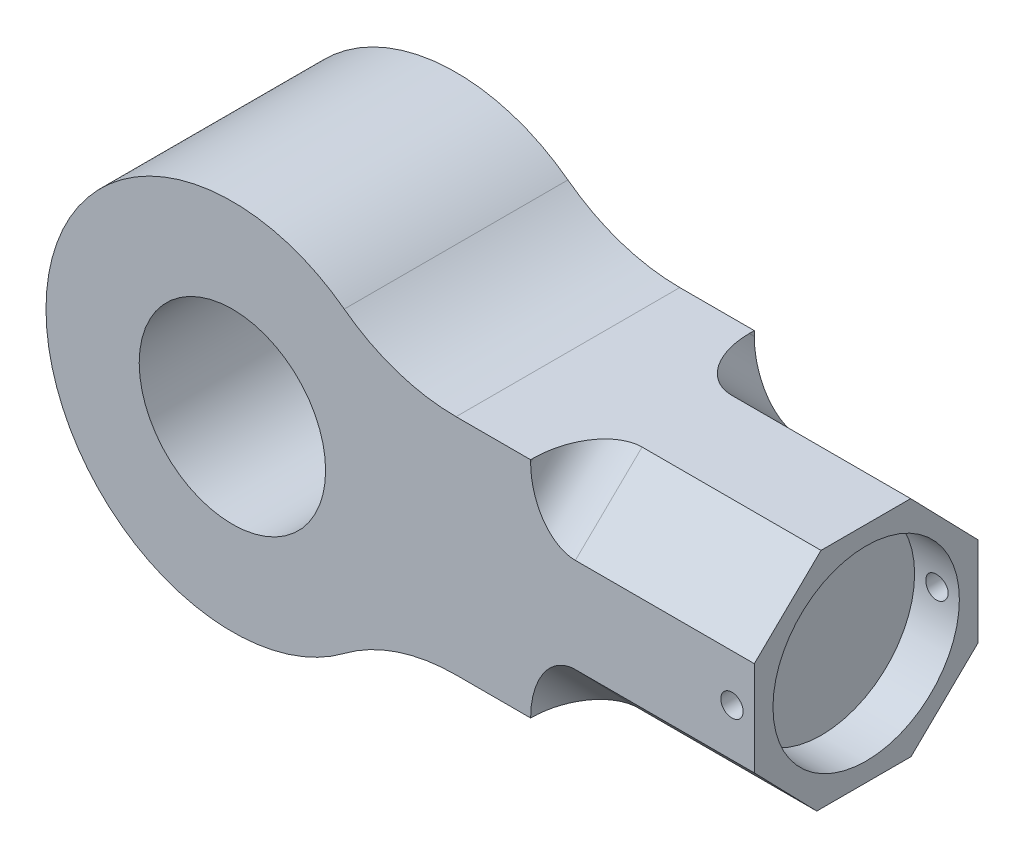
from build123d import *

# Parameters (mm, degrees)
SKETCH1_R              = 250
BOSS_EXTRUDE1_DEPTH    = 600
CUT_EXTRUDE6_DEPTH     = 600
CUT_EXTRUDE8_START     = -1
CUT_EXTRUDE8_OUTLINE_W = 600
CUT_EXTRUDE8_OUTLINE_H = 174.000412652
CUT_EXTRUDE8_DEPTH     = 1
FILLET2_R              = 120
SKETCH8_R              = 250
CUT_EXTRUDE10_DEPTH    = 120
SKETCH9_R              = 30
CUT_EXTRUDE11_DEPTH    = 1604.121954188


# Read off the part's stored shape, not the designer's step: Cut-Extrude8
with BuildPart() as part:
    # Sketch1 → Boss-Extrude1 (new body)
    with BuildSketch(Plane.XY):
        with BuildLine():
            Line((600, 300), (1400, 300))
            Line((1400, 300), (1400, -300))
            Line((1400, -300), (600, -300))
            ThreePointArc((600, -300), (441.886116992, -325.658350975), (300, -400))
            ThreePointArc((300, -400), (-500, 0), (300, 400))
            ThreePointArc((300, 400), (441.886116992, 325.658350975), (600, 300))
        make_face()
        Circle(SKETCH1_R, mode=Mode.SUBTRACT)
    extrude(amount=BOSS_EXTRUDE1_DEPTH)

    # Sketch2 → Cut-Extrude6 (cut)
    with BuildSketch(Plane(origin=(1400, 0, 0), x_dir=(0, 0, -1), z_dir=(1, 0, 0))):
        Polygon((-180.6, 300), (0, 114), (0, 300), align=None)
        Polygon((-600, -300), (-432.420494682, -300), (-600, -127.409811799), align=None)
        Polygon((-0.445053521, -300), (-0.445053521, -125.999587348), (-179.648136318, -300), align=None)
        Polygon((-606.599587348, 119.845053521), (-606.599587348, 300.445053521), (-420.599587348, 300.445053521), align=None)
    extrude(amount=-CUT_EXTRUDE6_DEPTH, mode=Mode.SUBTRACT)

    # Cut-Extrude8 outline → Cut-Extrude8 (cut)
    with BuildSketch(Plane(origin=(0, 0, 0), x_dir=(-1, 0, 0), z_dir=(0, 0, -1)).offset(CUT_EXTRUDE8_START)):
        with Locations((-1100, -212.999793674)):
            Rectangle(CUT_EXTRUDE8_OUTLINE_W, CUT_EXTRUDE8_OUTLINE_H)
    extrude(amount=CUT_EXTRUDE8_DEPTH, mode=Mode.SUBTRACT)

    # Fillet2
    fillet2_edges = [part.edges().sort_by_distance(p)[0] for p in [
        (800, 213.126519973, 510.528974059),
        (800, -213.269211239, 90.324068159),
        (800, -213.7049059, 516.210247341),
        (800, 207, 90.3),
    ]]
    fillet(fillet2_edges, radius=FILLET2_R)

    # Sketch8 → Cut-Extrude10 (cut)
    with BuildSketch(Plane(origin=(1400, 0, 0), x_dir=(0, 0, -1), z_dir=(1, 0, 0))):
        with Locations((-300, 0)):
            Circle(SKETCH8_R)
    extrude(amount=-CUT_EXTRUDE10_DEPTH, mode=Mode.SUBTRACT)

    # Sketch9 → Cut-Extrude11 (cut, through all)
    with BuildSketch(Plane(origin=(0, 0, 0), x_dir=(-1, 0, 0), z_dir=(0, 0, -1))):
        with Locations((-1340, 0)):
            Circle(SKETCH9_R)
    extrude(amount=-CUT_EXTRUDE11_DEPTH, mode=Mode.SUBTRACT)


solid = part.part
